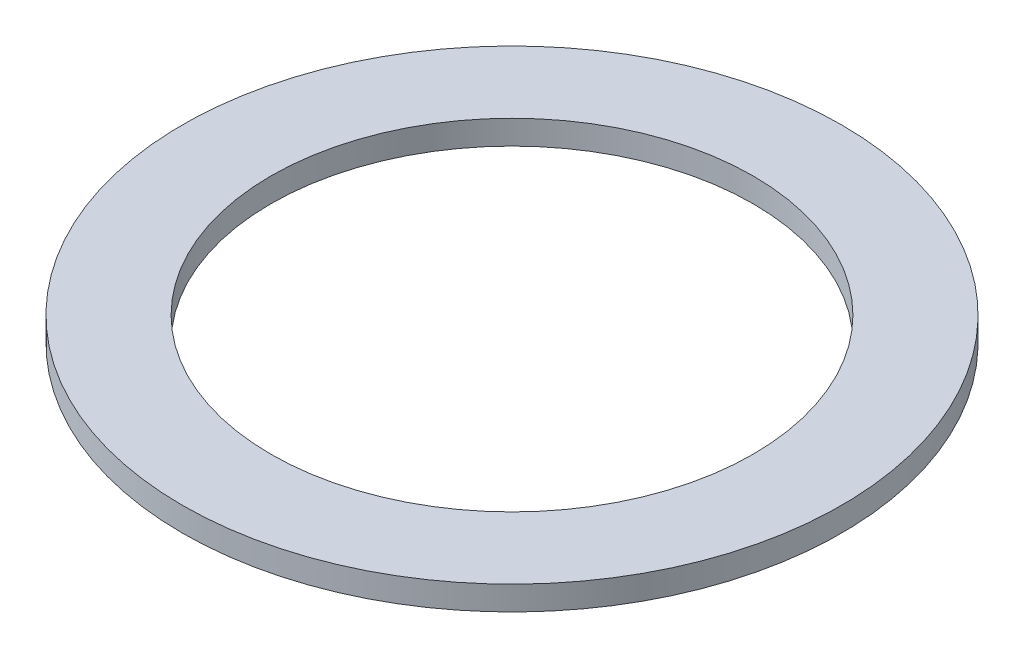
from build123d import *

# Parameters (mm, degrees)
SKETCH1_R           = 17.3609
SKETCH1_R_2         = 12.7
BOSS_EXTRUDE1_DEPTH = 0.635


with BuildPart() as part:
    # Sketch1 → Boss-Extrude1 (new, symmetric)
    with BuildSketch(Plane(origin=(0, 0, 0), x_dir=(1, 0, 0), z_dir=(0, 1, 0))):
        Circle(SKETCH1_R)
        Circle(SKETCH1_R_2, mode=Mode.SUBTRACT)
    extrude(amount=BOSS_EXTRUDE1_DEPTH, both=True)


solid = part.part
